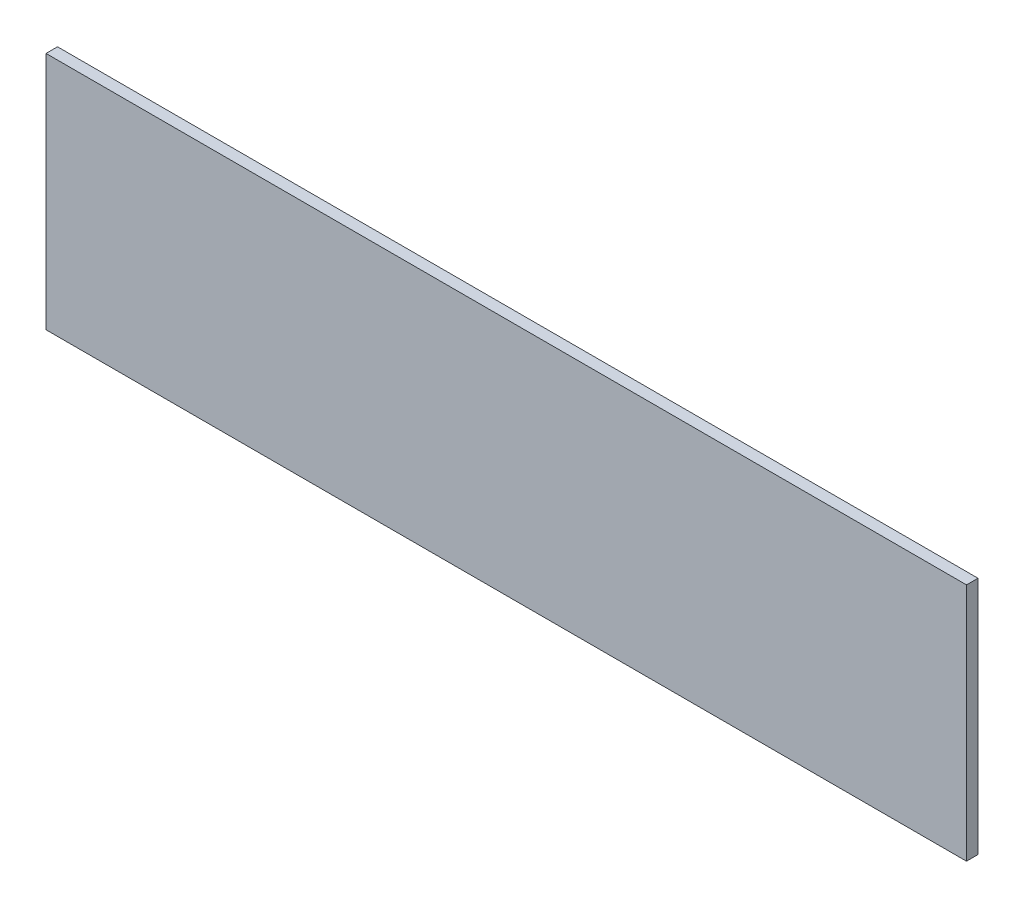
from build123d import *

# Parameters (mm, degrees)
SKETCH2_W           = 254
SKETCH2_H           = 66.04
BOSS_EXTRUDE1_DEPTH = 3.175


with BuildPart() as part:
    # Sketch2 → Boss-Extrude1 (new body)
    with BuildSketch(Plane.XY):
        with Locations((-127, 33.02)):
            Rectangle(SKETCH2_W, SKETCH2_H)
    extrude(amount=BOSS_EXTRUDE1_DEPTH)


solid = part.part
